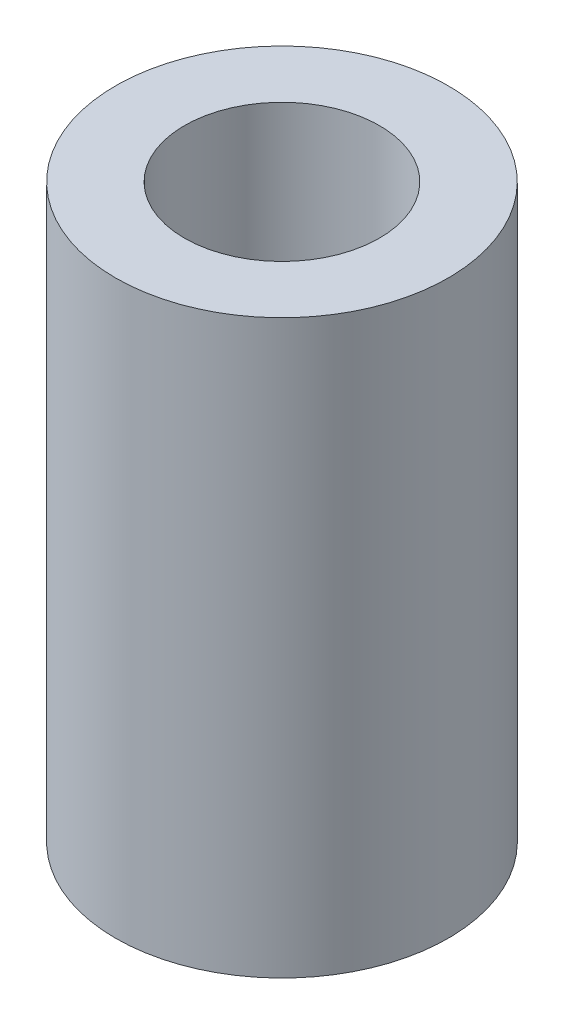
from build123d import *

# Parameters (mm, degrees)
SKETCH1_R           = 10
BOSS_EXTRUDE1_DEPTH = 34.364646853
SKETCH2_R           = 5.860459815
CUT_EXTRUDE1_DEPTH  = 38.16085243


with BuildPart() as part:
    # Sketch1 → Boss-Extrude1 (new body)
    with BuildSketch(Plane(origin=(0, 0, 0), x_dir=(1, 0, 0), z_dir=(0, 1, 0))):
        Circle(SKETCH1_R)
    extrude(amount=BOSS_EXTRUDE1_DEPTH)

    # Sketch2 → Cut-Extrude1 (cut, through all)
    with BuildSketch(Plane(origin=(0, 0, 0), x_dir=(1, 0, 0), z_dir=(0, 1, 0))):
        Circle(SKETCH2_R)
    extrude(amount=CUT_EXTRUDE1_DEPTH, mode=Mode.SUBTRACT)


solid = part.part
